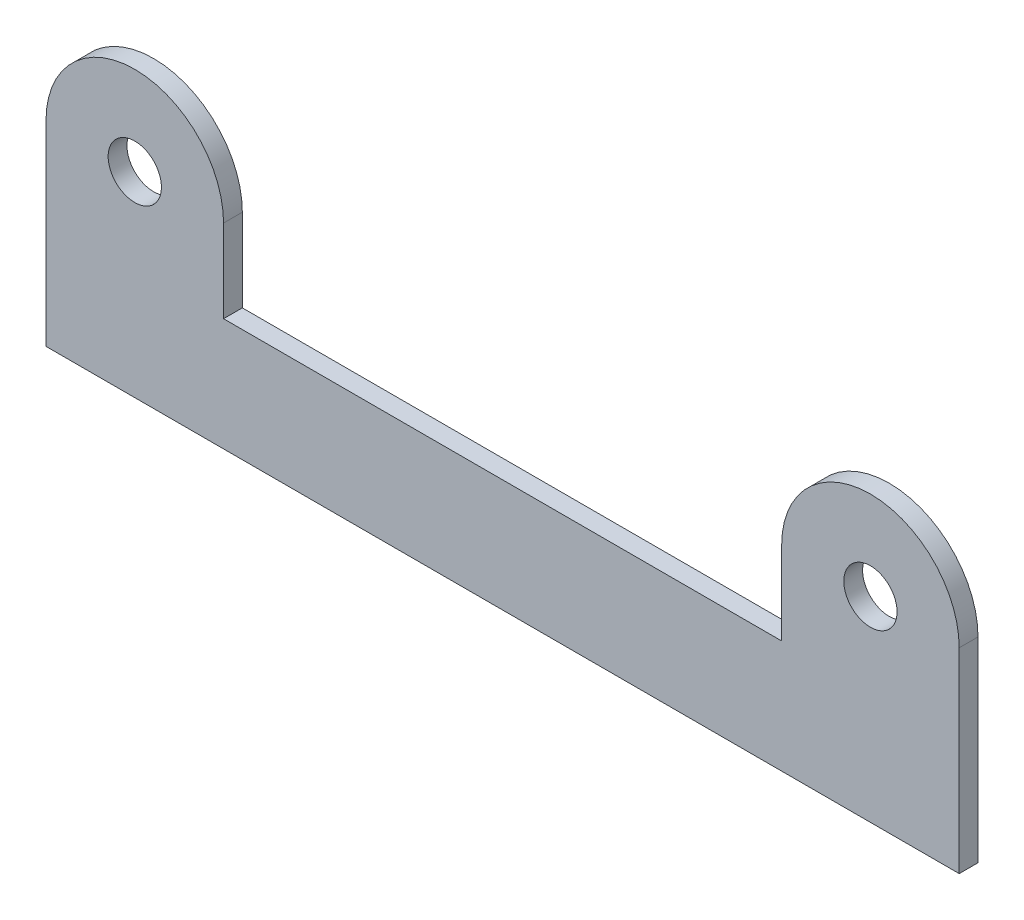
from build123d import *

# Parameters (mm, degrees)
BASE_FLANGE2_DEPTH   = 1.5875
M4_CLEARANCE_HOLE1_D = 4.5


# Read off the part's stored shape, not the designer's step: Base-Flange2
with BuildPart() as part:
    # Base-Flange2 outline → Base-Flange2 (new body)
    with BuildSketch(Plane(origin=(0, 0, 0), x_dir=(-1, 0, 0), z_dir=(0, 0, -1))):
        with BuildLine():
            Line((69.65, -9.525), (69.65, 7))
            ThreePointArc((69.65, 7), (62.15, 14.5), (54.65, 7))
            Line((54.65, 7), (54.65, 0))
            Line((54.65, 0), (7.5, 0))
            Line((7.5, 0), (7.5, 7))
            ThreePointArc((7.5, 7), (0, 14.5), (-7.5, 7))
            Line((-7.5, 7), (-7.5, -9.525))
            Line((-7.5, -9.525), (69.65, -9.525))
        make_face()
    extrude(amount=BASE_FLANGE2_DEPTH)

    # M4 Clearance Hole1 (through all)
    with Locations(Plane.XY):
        with Locations((0, 7), (-62.15, 7)):
            Hole(M4_CLEARANCE_HOLE1_D / 2)


solid = part.part
